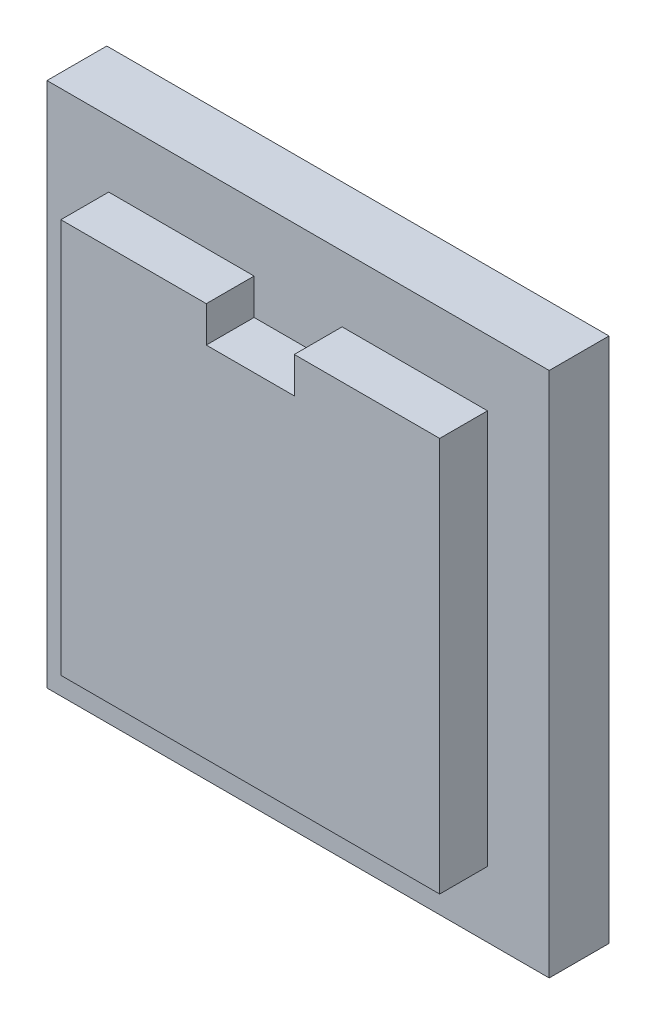
from build123d import *

# Parameters (mm, degrees)
BOSS_EXTRUDE1_DEPTH = 6.35
SKETCH2_W           = 66.675
SKETCH2_H           = 69.85
BOSS_EXTRUDE2_DEPTH = 3.175
SKETCH3_W           = 66.675
SKETCH3_H           = 69.85
BOSS_EXTRUDE3_DEPTH = 4.7625


with BuildPart() as part:
    # Sketch1 → Boss-Extrude1 (new body)
    with BuildSketch(Plane.XY):
        Polygon((-25.146, 26.19375), (-15.494, 26.19375), (-5.842, 26.19375), (-5.842, 21.43125), (5.842, 21.43125), (5.842, 26.19375), (15.494, 26.19375), (25.146, 26.19375), (25.146, -26.19375), (-25.146, -26.19375), align=None)
    extrude(amount=BOSS_EXTRUDE1_DEPTH)

    # Sketch2 → Boss-Extrude2 (add)
    with BuildSketch(Plane.XY):
        Rectangle(SKETCH2_W, SKETCH2_H)
    extrude(amount=-BOSS_EXTRUDE2_DEPTH)

    # Sketch3 → Boss-Extrude3 (add)
    with BuildSketch(Plane(origin=(0, 0, -3.175), x_dir=(-1, 0, 0), z_dir=(0, 0, -1))):
        Rectangle(SKETCH3_W, SKETCH3_H)
        Polygon((5.715, 27.305), (24.892, 27.305), (24.892, -27.305), (5.715, -27.305), (5.715, -22.733), (-5.715, -22.733), (-5.715, -27.305), (-24.892, -27.305), (-24.892, 27.305), (-5.715, 27.305), align=None, mode=Mode.SUBTRACT)
    extrude(amount=BOSS_EXTRUDE3_DEPTH)


solid = part.part
